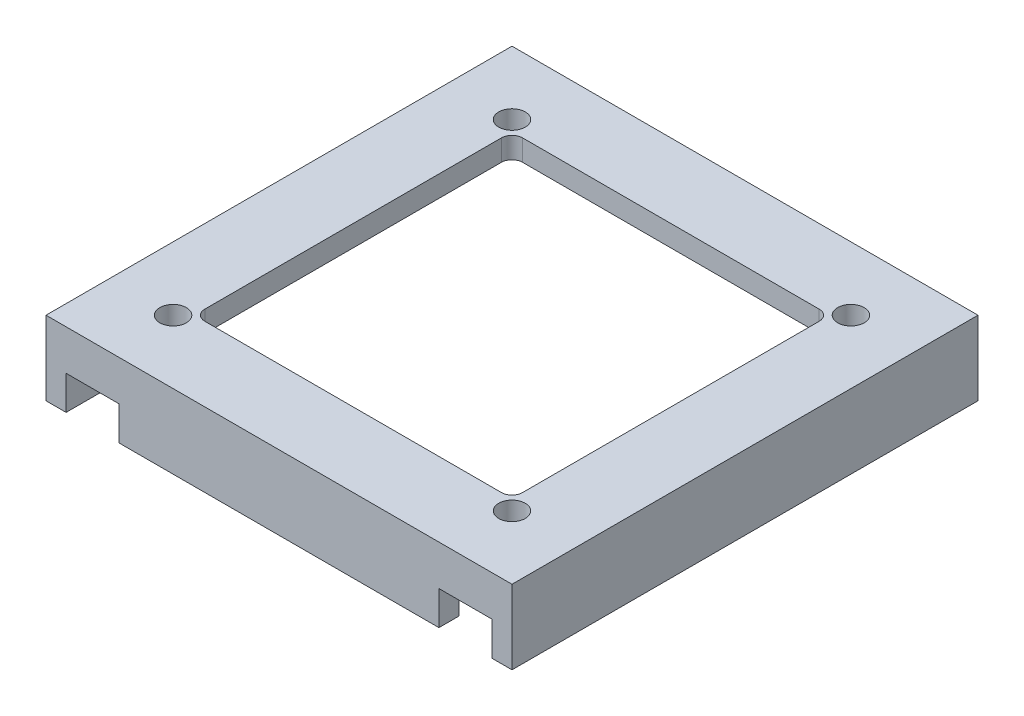
from build123d import *

# Parameters (mm, degrees)
SKETCH1_W               = 44
SKETCH1_H               = 44
BOSS_EXTRUDE1_DEPTH     = 5
SKETCH2_W               = 36
SKETCH2_H               = 36
BOSS_EXTRUDE2_DEPTH     = 1.8
CUT_EXTRUDE1_REACH      = 51.447
SKETCH3_W               = 5
SKETCH3_H               = 3.2
SKETCH4_W               = 44
SKETCH4_H               = 44
SKETCH4_W_2             = 30
SKETCH4_H_2             = 30
BOSS_EXTRUDE3_DEPTH     = 2
FILLET1_R               = 1
TAP_DRILL_FOR_M3_TAP1_D = 2.5


with BuildPart() as part:
    # Sketch1 → Boss-Extrude1 (new body)
    with BuildSketch(Plane(origin=(0, 0, 0), x_dir=(1, 0, 0), z_dir=(0, 1, 0))):
        Rectangle(SKETCH1_W, SKETCH1_H)
        Polygon((20.1, -20.1), (20.1, 21.1), (18.1, 21.1), (18.1, 20.1), (-18.1, 20.1), (-18.1, 21.1), (-20.1, 21.1), (-20.1, -20.1), align=None, mode=Mode.SUBTRACT)
    extrude(amount=BOSS_EXTRUDE1_DEPTH)

    # Sketch2 → Boss-Extrude2 (add)
    with BuildSketch(Plane(origin=(0, 5, 0), x_dir=(1, 0, 0), z_dir=(0, 1, 0))):
        Polygon((-20.1, 21.1), (-20.1, -20.1), (20.1, -20.1), (20.1, 21.1), (18.1, 21.1), (18.1, 20.1), (-18.1, 20.1), (-18.1, 21.1), align=None)
        Rectangle(SKETCH2_W, SKETCH2_H, mode=Mode.SUBTRACT)
    extrude(amount=-BOSS_EXTRUDE2_DEPTH)

    # Sketch3 → Cut-Extrude1 (cut, up to next)
    with BuildSketch(Plane.XY.offset(22), mode=Mode.PRIVATE) as cut_extrude1_sk1:
        with Locations((-17.6, 1.6)):
            Rectangle(SKETCH3_W, SKETCH3_H)
    cut_extrude1_tool1 = extrude(cut_extrude1_sk1.sketch, amount=-CUT_EXTRUDE1_REACH, mode=Mode.PRIVATE) & part.part
    # Sketch3 → Cut-Extrude1 (cut, up to next)
    with BuildSketch(Plane.XY.offset(22), mode=Mode.PRIVATE) as cut_extrude1_sk2:
        with Locations((17.6, 1.6)):
            Rectangle(SKETCH3_W, SKETCH3_H)
    cut_extrude1_tool2 = extrude(cut_extrude1_sk2.sketch, amount=-CUT_EXTRUDE1_REACH, mode=Mode.PRIVATE) & part.part
    add(cut_extrude1_tool1.solids().sort_by_distance((-17.6, 1.6, 22))[0], mode=Mode.SUBTRACT)
    add(cut_extrude1_tool2.solids().sort_by_distance((17.6, 1.6, 22))[0], mode=Mode.SUBTRACT)

    # Sketch4 → Boss-Extrude3 (add)
    with BuildSketch(Plane(origin=(0, 5, 0), x_dir=(1, 0, 0), z_dir=(0, 1, 0))):
        Rectangle(SKETCH4_W, SKETCH4_H)
        Rectangle(SKETCH4_W_2, SKETCH4_H_2, mode=Mode.SUBTRACT)
    extrude(amount=BOSS_EXTRUDE3_DEPTH)

    # Fillet1
    fillet1_edges = [part.edges().sort_by_distance(p)[0] for p in [
        (-18, 4.1, 18),
        (18, 4.1, 18),
        (18, 4.1, -18),
        (-18, 4.1, -18),
        (-20.1, 1.6, -21.1),
        (-18.1, 1.6, -21.1),
        (18.1, 1.6, -21.1),
        (20.1, 1.6, -21.1),
        (-15, 6, -15),
        (-15, 6, 15),
        (15, 6, -15),
        (15, 6, 15),
    ]]
    fillet(fillet1_edges, radius=FILLET1_R - 0.0001)  # a hair under: the kernel refuses the full size

    # Tap Drill for M3 Tap1 (through all)
    with Locations(Plane(origin=(0, 7, 0), x_dir=(1, 0, 0), z_dir=(0, 1, 0))):
        with Locations((-16, 16), (16, 16), (16, -16), (-16, -16)):
            Hole(TAP_DRILL_FOR_M3_TAP1_D / 2)


solid = part.part
